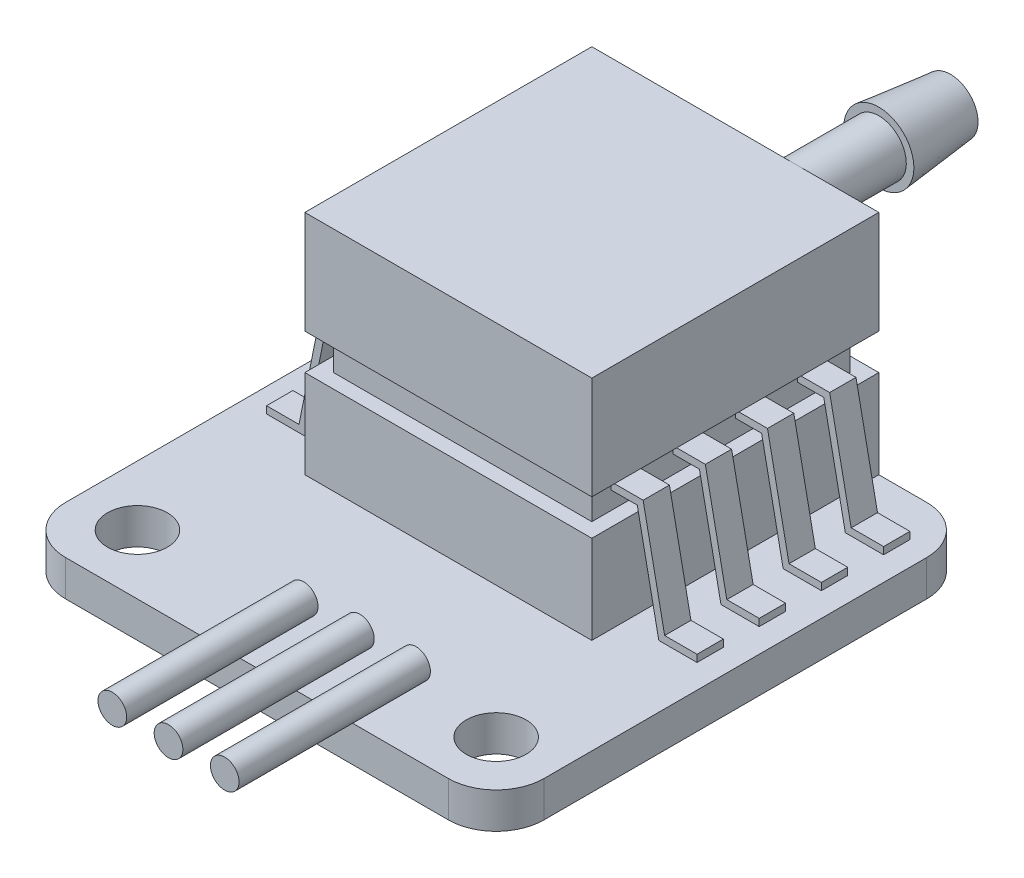
from build123d import *

# Parameters (mm, degrees)
SKETCH_1_R                = 1.25
EXTRUDE_1_DEPTH           = 1.5
SKETCH_2_W                = 12
SKETCH_2_H                = 12
EXTRUDE_2_DEPTH           = 9.5
CUT_EXTRUDE_START         = 3.7
SKETCH_3_OUTSIDE_W        = 28.07
SKETCH_3_OUTSIDE_H        = 28.07
SKETCH_3_OUTSIDE_W_2      = 10.8
SKETCH_3_OUTSIDE_H_2      = 10.8
CUT_EXTRUDE_1_DEPTH       = 1.5
SKETCH_4_R                = 1.15
SKETCH_4_R_2              = 0.6
EXTRUDE_3_DEPTH           = 6.5
SKETCH_5_R                = 1.15
SKETCH_5_R_2              = 0.6
EXTRUDE_4_DEPTH           = 3
EXTRUDE_4_DRAFT           = 6
EXTRUDE_4_PROFILE_2_DEPTH = 3
EXTRUDE_4_PROFILE_2_DRAFT = 6
EXTRUDE_START             = -1.7
EXTRUDE_1_2_DEPTH         = 1.1
PATTERN_LINEAR_1_COUNT    = 4
PATTERN_LINEAR_1_PITCH    = 2.6
EXTRUDE_5_DEPTH           = 5
EXTRUDE_5_DEPTH_BACK      = 3
SKETCH_7_R                = 0.6


with BuildPart() as part:
    # Эскиз1 → Extrude 1 (new body)
    with BuildSketch(Plane(origin=(0, 0, 0), x_dir=(1, 0, 0), z_dir=(0, 1, 0))):
        with BuildLine():
            Line((2, 0), (18, 0))
            ThreePointArc((18, 0), (19.414213562, 0.585786438), (20, 2))
            Line((20, 2), (20, 18))
            ThreePointArc((20, 18), (19.414213562, 19.414213562), (18, 20))
            Line((18, 20), (2, 20))
            ThreePointArc((2, 20), (0.585786438, 19.414213562), (0, 18))
            Line((0, 18), (0, 2))
            ThreePointArc((0, 2), (0.585786438, 0.585786438), (2, 0))
        make_face()
        with Locations((2.5, 2.5)):
            Circle(SKETCH_1_R, mode=Mode.SUBTRACT)
        with Locations((17.5, 2.5)):
            Circle(SKETCH_1_R, mode=Mode.SUBTRACT)
    extrude(amount=EXTRUDE_1_DEPTH)

    # Эскиз2 → Бобышка-Вытянуть2 (add)
    with BuildSketch(Plane(origin=(0, 1.5, 0), x_dir=(1, 0, 0), z_dir=(0, 1, 0))):
        with Locations((10, 14)):
            Rectangle(SKETCH_2_W, SKETCH_2_H)
    extrude(amount=EXTRUDE_2_DEPTH)

    # Эскиз3 outside → Вырез-Вытянуть1 (cut)
    with BuildSketch(Plane(origin=(0, 1.5, 0), x_dir=(1, 0, 0), z_dir=(0, 1, 0)).offset(CUT_EXTRUDE_START)):
        with Locations((10, 10)):
            Rectangle(SKETCH_3_OUTSIDE_W, SKETCH_3_OUTSIDE_H)
        with Locations((10, 14)):
            Rectangle(SKETCH_3_OUTSIDE_W_2, SKETCH_3_OUTSIDE_H_2, mode=Mode.SUBTRACT)
    extrude(amount=CUT_EXTRUDE_1_DEPTH, mode=Mode.SUBTRACT)

    # Эскиз4 → Бобышка-Вытянуть3 (add)
    # profile 1 of 2: a face of its own
    with BuildSketch(Plane(origin=(0, 0, -20), x_dir=(-1, 0, 0), z_dir=(0, 0, -1))):
        with Locations((-12.5, 9.85)):
            Circle(SKETCH_4_R)
        with Locations((-12.5, 9.85)):
            Circle(SKETCH_4_R_2, mode=Mode.SUBTRACT)
    # profile 2 of 2: a face of its own
    with BuildSketch(Plane(origin=(0, 0, -20), x_dir=(-1, 0, 0), z_dir=(0, 0, -1))):
        with Locations((-7.5, 2.65)):
            Circle(SKETCH_4_R)
        with Locations((-7.5, 2.65)):
            Circle(SKETCH_4_R_2, mode=Mode.SUBTRACT)
    extrude(amount=EXTRUDE_3_DEPTH)


with BuildPart() as extrude_4_tool:
    # Эскиз5 → Бобышка-Вытянуть4 (with draft: the straight prism first)
    with BuildSketch(Plane(origin=(0, 0, -26.5), x_dir=(-1, 0, 0), z_dir=(0, 0, -1))):
        with Locations((-7.5, 2.65)):
            Circle(SKETCH_5_R)
        with Locations((-7.5, 2.65)):
            Circle(SKETCH_5_R_2, mode=Mode.SUBTRACT)
    extrude(amount=-EXTRUDE_4_DEPTH)
    # Бобышка-Вытянуть4: the draft: its side faces are tilted about the plane it starts from
    extrude_4_sides = [extrude_4_tool.faces().sort_by_distance(p)[0] for p in [
        (8.65, 2.65, -25),
        (8.1, 2.65, -25),
    ]]
    draft(extrude_4_sides, Plane(origin=(0, 0, -26.5), x_dir=(-1, 0, 0), z_dir=(0, 0, -1)), EXTRUDE_4_DRAFT)


with BuildPart() as part_1:
    add(part.part)

    # Бобышка-Вытянуть4: add extrude_4_tool
    add(extrude_4_tool.part)


with BuildPart() as extrude_4_profile_2_tool:
    # Эскиз5 → Бобышка-Вытянуть4 profile 2 (with draft: the straight prism first)
    with BuildSketch(Plane(origin=(0, 0, -26.5), x_dir=(-1, 0, 0), z_dir=(0, 0, -1))):
        with Locations((-12.5, 9.85)):
            Circle(SKETCH_5_R)
        with Locations((-12.5, 9.85)):
            Circle(SKETCH_5_R_2, mode=Mode.SUBTRACT)
    extrude(amount=-EXTRUDE_4_PROFILE_2_DEPTH)
    # Бобышка-Вытянуть4 profile 2: the draft: its side faces are tilted about the plane it starts from
    extrude_4_profile_2_sides = [extrude_4_profile_2_tool.faces().sort_by_distance(p)[0] for p in [
        (13.65, 9.85, -25),
        (13.1, 9.85, -25),
    ]]
    draft(extrude_4_profile_2_sides, Plane(origin=(0, 0, -26.5), x_dir=(-1, 0, 0), z_dir=(0, 0, -1)), EXTRUDE_4_PROFILE_2_DRAFT)


with BuildPart() as part_2:
    add(part_1.part)

    # Бобышка-Вытянуть4 profile 2: add extrude_4_profile_2_tool
    add(extrude_4_profile_2_tool.part)

    # Эскиз6 → Extrude 1 2 (add)
    with BuildSketch(Plane(origin=(0, 0, -20), x_dir=(-1, 0, 0), z_dir=(0, 0, -1)).offset(EXTRUDE_START)):
        Polygon((-15.4, 5.95), (-16.5, 5.95), (-17.4, 1.5), (-19, 1.5), (-19, 1.8), (-17.645399941, 1.8), (-16.745399941, 6.25), (-15.4, 6.25), align=None)
        Polygon((-1, 1.5), (-2.6, 1.5), (-3.5, 5.95), (-4.6, 5.95), (-4.6, 6.25), (-3.254600059, 6.25), (-2.354600059, 1.8), (-1, 1.8), align=None)
    extrude_1_2 = extrude(amount=-EXTRUDE_1_2_DEPTH)

    # Линейный массив1: Extrude 1 2 ×4
    with Locations(*[(0, 0, i * PATTERN_LINEAR_1_PITCH) for i in range(1, PATTERN_LINEAR_1_COUNT)]):
        add(extrude_1_2)

    # Эскиз7 → Бобышка-Вытянуть5 (add, two sides: drawn at the far end of the back side and taken through both)
    with BuildSketch(Plane.XY.offset(-EXTRUDE_5_DEPTH_BACK)):
        with Locations((8.95, 2)):
            Circle(SKETCH_7_R)
        with Locations((11.3, 2)):
            Circle(SKETCH_7_R)
        with Locations((13.65, 2)):
            Circle(SKETCH_7_R)
    extrude(amount=EXTRUDE_5_DEPTH + EXTRUDE_5_DEPTH_BACK)


solid = part_2.part
